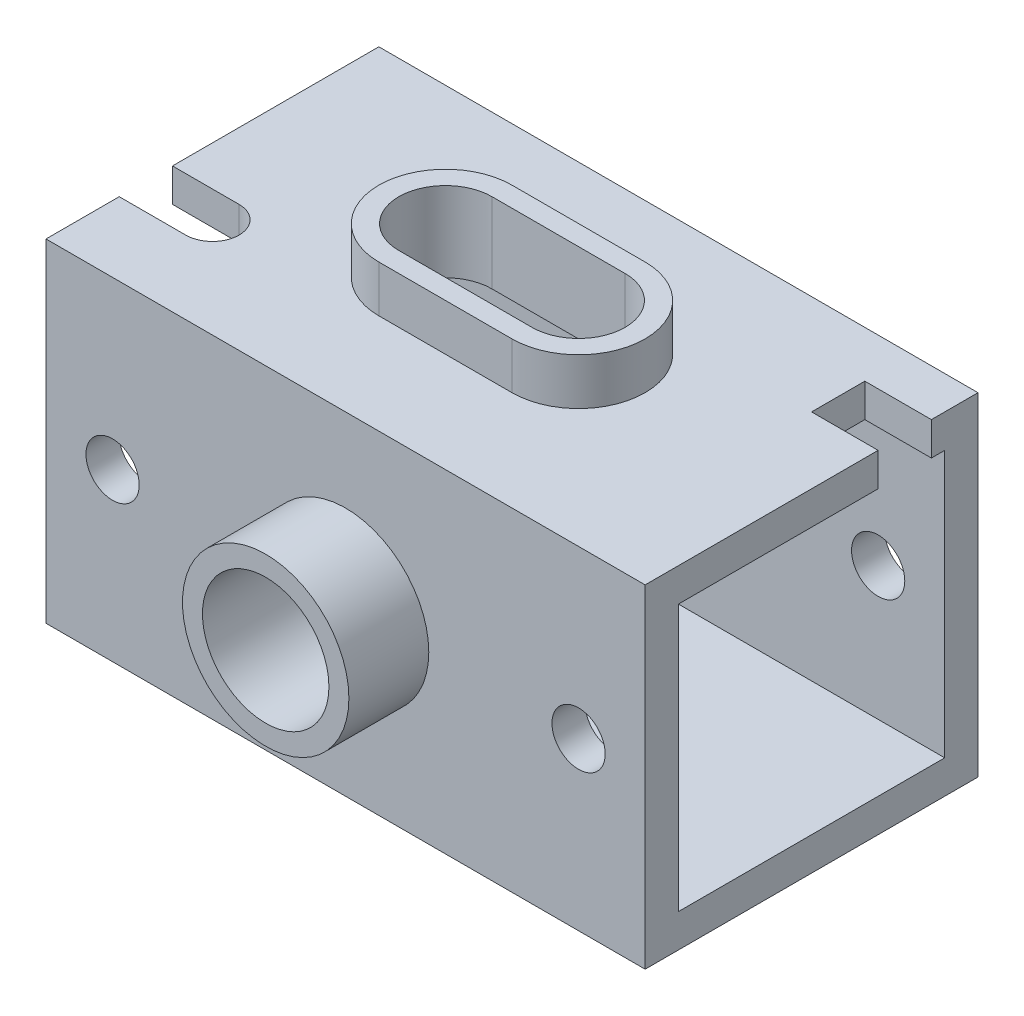
from build123d import *

# Parameters (mm, degrees)
SKETCH1_W                = 90
SKETCH1_H                = 5
BOSS_EXTRUDE1_DEPTH      = 25
BOSS_EXTRUDE1_2_DEPTH    = 25
EXTRUDE_START            = 25
SKETCH1_3_W              = 80
SKETCH1_3_H              = 40
SKETCH1_3_R              = 4
SKETCH1_3_R_2            = 12.5
EXTRUDE_S_DEPTH          = 5
BOSS_EXTRUDE3_DEPTH      = 12
BOSS_EXTRUDE3_DEPTH_BACK = 5
BOSS_EXTRUDE3_START      = 25
SKETCH1_4_R              = 12.5
SKETCH1_4_R_2            = 9.5
BOSS_EXTRUDE4_START      = 20
BOSS_EXTRUDE4_OUTLINE_W  = 5
BOSS_EXTRUDE4_OUTLINE_H  = 40
BOSS_EXTRUDE4_DEPTH      = 5
BOSS_EXTRUDE5_START      = -25
SKETCH1_6_R              = 12.5
SKETCH1_6_R_2            = 9.5
BOSS_EXTRUDE5_DEPTH      = 12
SKETCH2_W                = 10
SKETCH2_H                = 8
CUT_EXTRUDE1_DEPTH       = 5
BOSS_EXTRUDE6_START      = 7
BOSS_EXTRUDE6_DEPTH      = 7


# Read off the part's stored shape, not the designer's step: Boss-Extrude4
with BuildPart() as part:
    # Sketch1 → Boss-Extrude1 (new, symmetric)
    with BuildSketch(Plane.XY):
        with Locations((0, -22.5)):
            Rectangle(SKETCH1_W, SKETCH1_H)
    extrude(amount=BOSS_EXTRUDE1_DEPTH, both=True)

    # Sketch1<3> → s (add)
    with BuildSketch(Plane.XY.offset(EXTRUDE_START)):
        Rectangle(SKETCH1_3_W, SKETCH1_3_H)
        with Locations((-35, 0)):
            Circle(SKETCH1_3_R, mode=Mode.SUBTRACT)
        Circle(SKETCH1_3_R_2, mode=Mode.SUBTRACT)
        with Locations((35, 0)):
            Circle(SKETCH1_3_R, mode=Mode.SUBTRACT)
    extrude_s = extrude(amount=-EXTRUDE_S_DEPTH)



with BuildPart() as body_2:
    # Sketch1 → Boss-Extrude1 2 (new, symmetric)
    with BuildSketch(Plane.XY):
        with Locations((0, 22.5)):
            Rectangle(SKETCH1_W, SKETCH1_H)
    extrude(amount=BOSS_EXTRUDE1_2_DEPTH, both=True)


with BuildPart() as body_3:
    # Sketch1<4> → Boss-Extrude3 (new, two sides: drawn at the far end of the back side and taken through both)
    with BuildSketch(Plane.XY.offset(BOSS_EXTRUDE3_START - BOSS_EXTRUDE3_DEPTH_BACK)):
        Circle(SKETCH1_4_R)
        Circle(SKETCH1_4_R_2, mode=Mode.SUBTRACT)
    extrude(amount=BOSS_EXTRUDE3_DEPTH + BOSS_EXTRUDE3_DEPTH_BACK)


with BuildPart() as part_1:
    add(part.part)

    add(body_2.part)  # Boss-Extrude4 merges body 2
    # Boss-Extrude4 outline → Boss-Extrude4 (add)
    with BuildSketch(Plane.XY.offset(BOSS_EXTRUDE4_START)):
        with Locations((-42.5, 0)):
            Rectangle(BOSS_EXTRUDE4_OUTLINE_W, BOSS_EXTRUDE4_OUTLINE_H)
        with Locations((42.5, 0)):
            Rectangle(BOSS_EXTRUDE4_OUTLINE_W, BOSS_EXTRUDE4_OUTLINE_H)
    boss_extrude4 = extrude(amount=BOSS_EXTRUDE4_DEPTH)

    # Mirror3: s, Boss-Extrude4 across plane
    add(extrude_s.mirror(Plane.XY))
    add(boss_extrude4.mirror(Plane.XY))

    # Sketch2 → Cut-Extrude1 (cut)
    with BuildSketch(Plane(origin=(0, 25, 0), x_dir=(1, 0, 0), z_dir=(0, 1, 0))):
        with BuildLine():
            Line((-35, -6), (-45, -6))
            Line((-45, -6), (-45, -14))
            Line((-45, -14), (-35, -14))
            ThreePointArc((-35, -14), (-31, -10), (-35, -6))
        make_face()
        with Locations((40, 14)):
            Rectangle(SKETCH2_W, SKETCH2_H)
        with BuildLine():
            Line((-10, 7), (10, 7))
            ThreePointArc((10, 7), (17, 0), (10, -7))
            Line((10, -7), (-10, -7))
            ThreePointArc((-10, -7), (-17, 0), (-10, 7))
        make_face()
    extrude(amount=-CUT_EXTRUDE1_DEPTH, mode=Mode.SUBTRACT)

    # Sketch2<3> → Boss-Extrude6 (add)
    with BuildSketch(Plane(origin=(0, 25, 0), x_dir=(1, 0, 0), z_dir=(0, 1, 0)).offset(BOSS_EXTRUDE6_START)):
        with BuildLine():
            Line((-10, -10), (10, -10))
            ThreePointArc((10, -10), (20, 0), (10, 10))
            Line((10, 10), (-10, 10))
            ThreePointArc((-10, 10), (-20, 0), (-10, -10))
        make_face()
        with BuildLine():
            ThreePointArc((-10, 7), (-17, 0), (-10, -7))
            Line((-10, -7), (10, -7))
            ThreePointArc((10, -7), (17, 0), (10, 7))
            Line((10, 7), (-10, 7))
        make_face(mode=Mode.SUBTRACT)
    extrude(amount=-BOSS_EXTRUDE6_DEPTH)


with BuildPart() as body_3_2:
    # Sketch1<6> → Boss-Extrude5 (new body)
    with BuildSketch(Plane.XY.offset(BOSS_EXTRUDE5_START)):
        Circle(SKETCH1_6_R)
        Circle(SKETCH1_6_R_2, mode=Mode.SUBTRACT)
    extrude(amount=-BOSS_EXTRUDE5_DEPTH)


solid = Compound([body_3.part, part_1.part, body_3_2.part])
